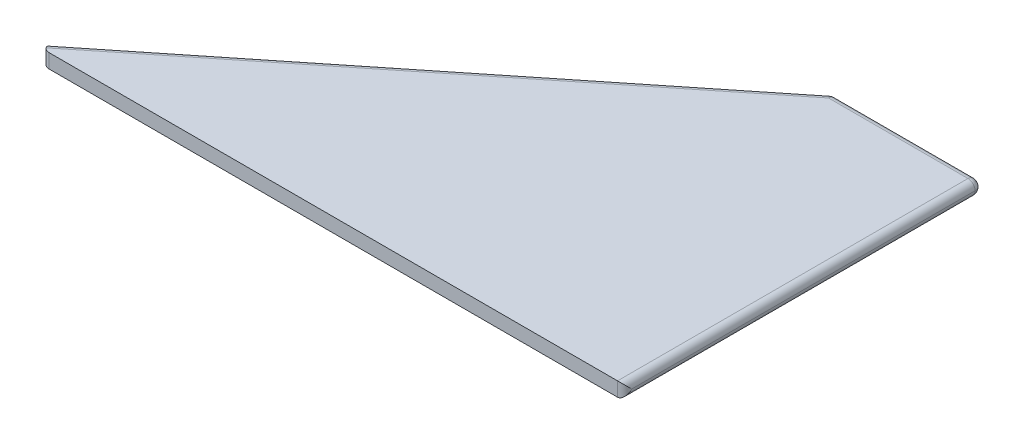
from build123d import *

# Parameters (mm, degrees)
BOSS_EXTRUDE1_DEPTH = 4.76
FILLET3_R           = 2.38


with BuildPart() as part:
    # Sketch1 → Boss-Extrude1 (new body)
    with BuildSketch(Plane(origin=(0, 0, 0), x_dir=(1, 0, 0), z_dir=(0, 1, 0))):
        Polygon((0, 0), (0, 120), (-50, 120), (-200, 0), align=None)
    extrude(amount=BOSS_EXTRUDE1_DEPTH)

    # Fillet3
    fillet3_edges = [part.edges().sort_by_distance(p)[0] for p in [
        (-25, 4.76, -120),
        (-125, 4.76, -60),
        (-125, 0, -60),
        (-25, 0, -120),
        (0, 0, -60),
        (-200, 2.38, 0),
        (-50, 2.38, -120),
        (0, 2.38, -120),
        (0, 2.38, 0),
        (0, 4.76, -60),
    ]]
    fillet(fillet3_edges, radius=FILLET3_R - 0.0001)  # a hair under: the kernel refuses the full size


solid = part.part
